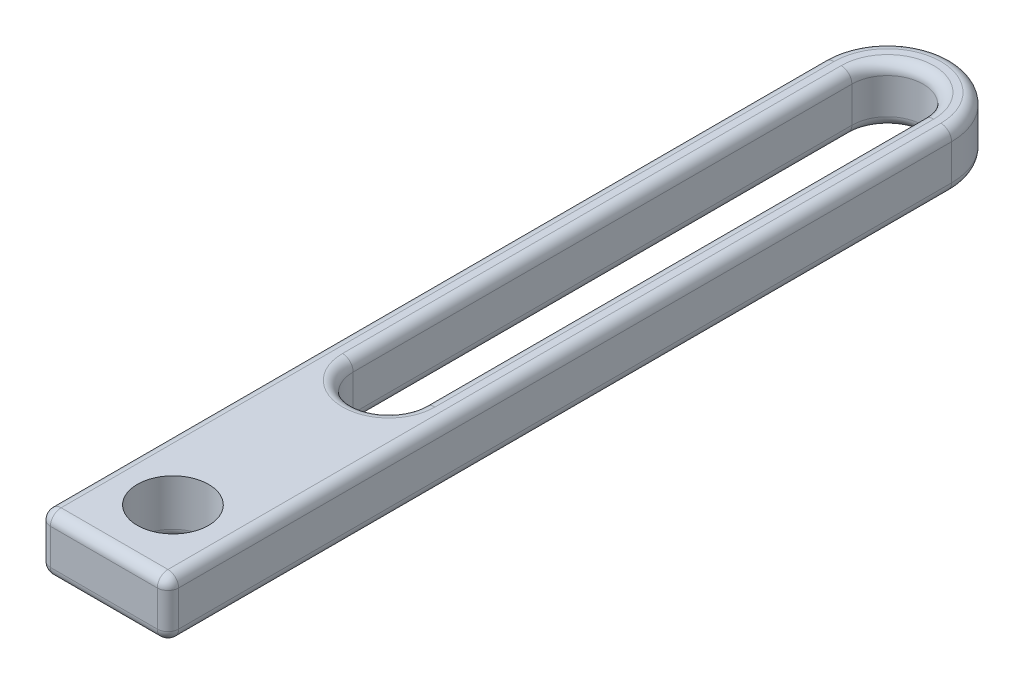
from build123d import *

# Parameters (mm, degrees)
SKETCH1_R           = 2.5
BOSS_EXTRUDE1_DEPTH = 4
FILLET1_R           = 0.75


with BuildPart() as part:
    # Sketch1 → Boss-Extrude1 (new body)
    with BuildSketch(Plane(origin=(0, 0, 0), x_dir=(1, 0, 0), z_dir=(0, 1, 0))):
        with BuildLine():
            Line((-4.5, -17.5), (-4.5, 17.5))
            ThreePointArc((-4.5, 17.5), (0, 22), (4.5, 17.5))
            Line((4.5, 17.5), (4.5, -17.5))
            Line((4.5, -17.5), (4.5, -37.5))
            Line((4.5, -37.5), (-4.5, -37.5))
            Line((-4.5, -37.5), (-4.5, -17.5))
        make_face()
        with Locations((0, -32.64915748)):
            Circle(SKETCH1_R, mode=Mode.SUBTRACT)
        with BuildLine():
            Line((-2.5, -17.5), (-2.5, 17.5))
            ThreePointArc((-2.5, 17.5), (0, 20), (2.5, 17.5))
            Line((2.5, 17.5), (2.5, -17.5))
            ThreePointArc((2.5, -17.5), (0, -20), (-2.5, -17.5))
        make_face(mode=Mode.SUBTRACT)
    extrude(amount=BOSS_EXTRUDE1_DEPTH)

    # Fillet1
    fillet1_edges = [part.edges().sort_by_distance(p)[0] for p in [
        (-4.5, 4, 10),
        (-4.5, 2, 37.5),
        (0, 4, 37.5),
        (-2.5, 0, 0),
        (0, 0, -20),
        (2.5, 0, 0),
        (0, 0, 20),
        (-4.5, 0, 10),
        (0, 0, 37.5),
        (0, 4, -22),
        (0, 0, -22),
        (4.5, 2, 37.5),
        (4.5, 4, 10),
        (4.5, 0, 10),
        (0, 4, 20),
        (-2.5, 4, 0),
        (0, 4, -20),
        (2.5, 4, 0),
        (-2.5, 0, 32.64915748),
    ]]
    fillet(fillet1_edges, radius=FILLET1_R)


solid = part.part
